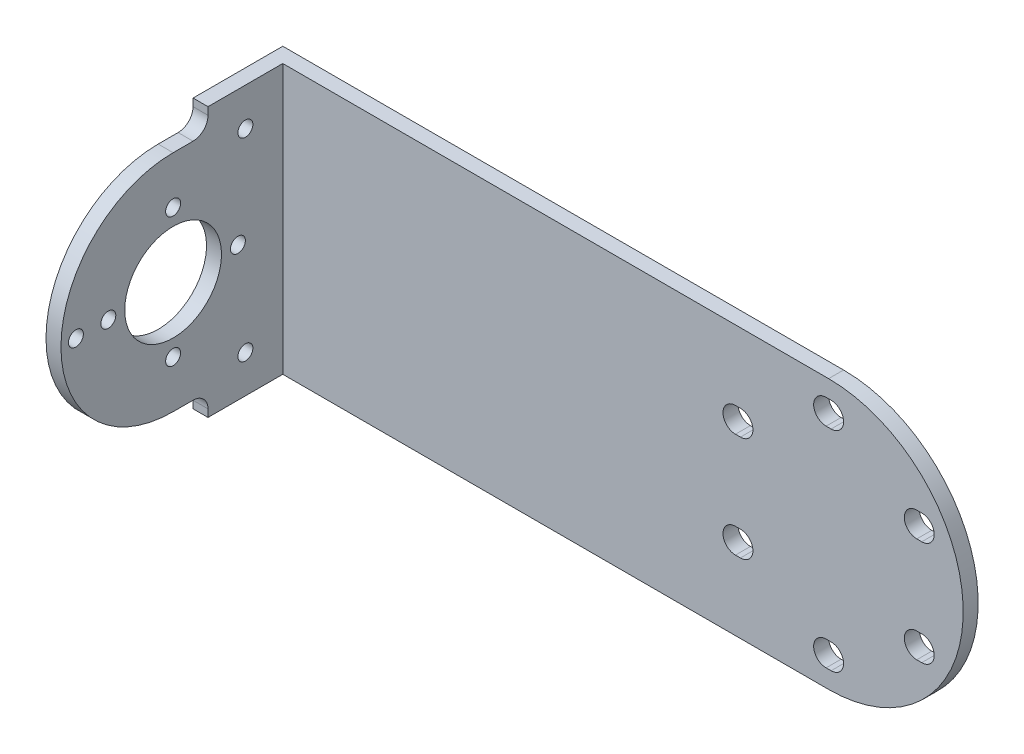
from build123d import *

# Parameters (mm, degrees)
BOSS_EXTRUDE1_DEPTH = 3
SKETCH2_R           = 1.5
SKETCH2_R_2         = 9.7
BOSS_EXTRUDE2_DEPTH = 3


with BuildPart() as part:
    # Sketch1 → Boss-Extrude1 (new body)
    with BuildSketch(Plane.XY):
        with BuildLine():
            Line((0, 27), (-112.5, 27))
            Line((-112.5, 27), (-112.5, -27))
            Line((-112.5, -27), (0, -27))
            ThreePointArc((0, -27), (27, 0), (0, 27))
        make_face()
        with BuildLine():
            ThreePointArc((-0.5, -23.5), (-3, -21), (-0.5, -18.5))
            Line((-0.5, -18.5), (0.5, -18.5))
            ThreePointArc((0.5, -18.5), (3, -21), (0.5, -23.5))
            Line((0.5, -23.5), (-0.5, -23.5))
        make_face(mode=Mode.SUBTRACT)
        with BuildLine():
            ThreePointArc((-18.686533479, -13), (-21.186533479, -10.5), (-18.686533479, -8))
            Line((-18.686533479, -8), (-17.686533479, -8))
            ThreePointArc((-17.686533479, -8), (-15.186533479, -10.5), (-17.686533479, -13))
            Line((-17.686533479, -13), (-18.686533479, -13))
        make_face(mode=Mode.SUBTRACT)
        with BuildLine():
            ThreePointArc((17.686533479, -13), (15.186533479, -10.5), (17.686533479, -8))
            Line((17.686533479, -8), (18.686533479, -8))
            ThreePointArc((18.686533479, -8), (21.186533479, -10.5), (18.686533479, -13))
            Line((18.686533479, -13), (17.686533479, -13))
        make_face(mode=Mode.SUBTRACT)
        with BuildLine():
            ThreePointArc((-17.686533479, 13), (-15.186533479, 10.5), (-17.686533479, 8))
            Line((-17.686533479, 8), (-18.686533479, 8))
            ThreePointArc((-18.686533479, 8), (-21.186533479, 10.5), (-18.686533479, 13))
            Line((-18.686533479, 13), (-17.686533479, 13))
        make_face(mode=Mode.SUBTRACT)
        with BuildLine():
            ThreePointArc((17.686533479, 8), (15.186533479, 10.5), (17.686533479, 13))
            Line((17.686533479, 13), (18.686533479, 13))
            ThreePointArc((18.686533479, 13), (21.186533479, 10.5), (18.686533479, 8))
            Line((18.686533479, 8), (17.686533479, 8))
        make_face(mode=Mode.SUBTRACT)
        with BuildLine():
            ThreePointArc((0.5, 23.5), (3, 21), (0.5, 18.5))
            Line((0.5, 18.5), (-0.5, 18.5))
            ThreePointArc((-0.5, 18.5), (-3, 21), (-0.5, 23.5))
            Line((-0.5, 23.5), (0.5, 23.5))
        make_face(mode=Mode.SUBTRACT)
    extrude(amount=BOSS_EXTRUDE1_DEPTH)

    # Sketch2 → Boss-Extrude2 (add)
    with BuildSketch(Plane.ZY.offset(112.5)):
        with BuildLine():
            Line((3, 27), (3, -27))
            Line((3, -27), (18, -27))
            Line((18, -27), (18, -25.5))
            ThreePointArc((18, -25.5), (18.878679656, -23.378679656), (21, -22.5))
            Line((21, -22.5), (25, -22.5))
            ThreePointArc((25, -22.5), (47.5, 0), (25, 22.5))
            Line((25, 22.5), (21, 22.5))
            ThreePointArc((21, 22.5), (18.878679656, 23.378679656), (18, 25.5))
            Line((18, 25.5), (18, 27))
            Line((18, 27), (3, 27))
        make_face()
        with Locations((10.5, -19.437399517)):
            Circle(SKETCH2_R, mode=Mode.SUBTRACT)
        with Locations((12, 0)):
            Circle(SKETCH2_R, mode=Mode.SUBTRACT)
        with Locations((25, -13)):
            Circle(SKETCH2_R, mode=Mode.SUBTRACT)
        with Locations((25, 0)):
            Circle(SKETCH2_R_2, mode=Mode.SUBTRACT)
        with Locations((25, 13)):
            Circle(SKETCH2_R, mode=Mode.SUBTRACT)
        with Locations((10.5, 19.437399517)):
            Circle(SKETCH2_R, mode=Mode.SUBTRACT)
        with Locations((38, 0)):
            Circle(SKETCH2_R, mode=Mode.SUBTRACT)
        with Locations((44.5, 0)):
            Circle(SKETCH2_R, mode=Mode.SUBTRACT)
    extrude(amount=-BOSS_EXTRUDE2_DEPTH)


solid = part.part
